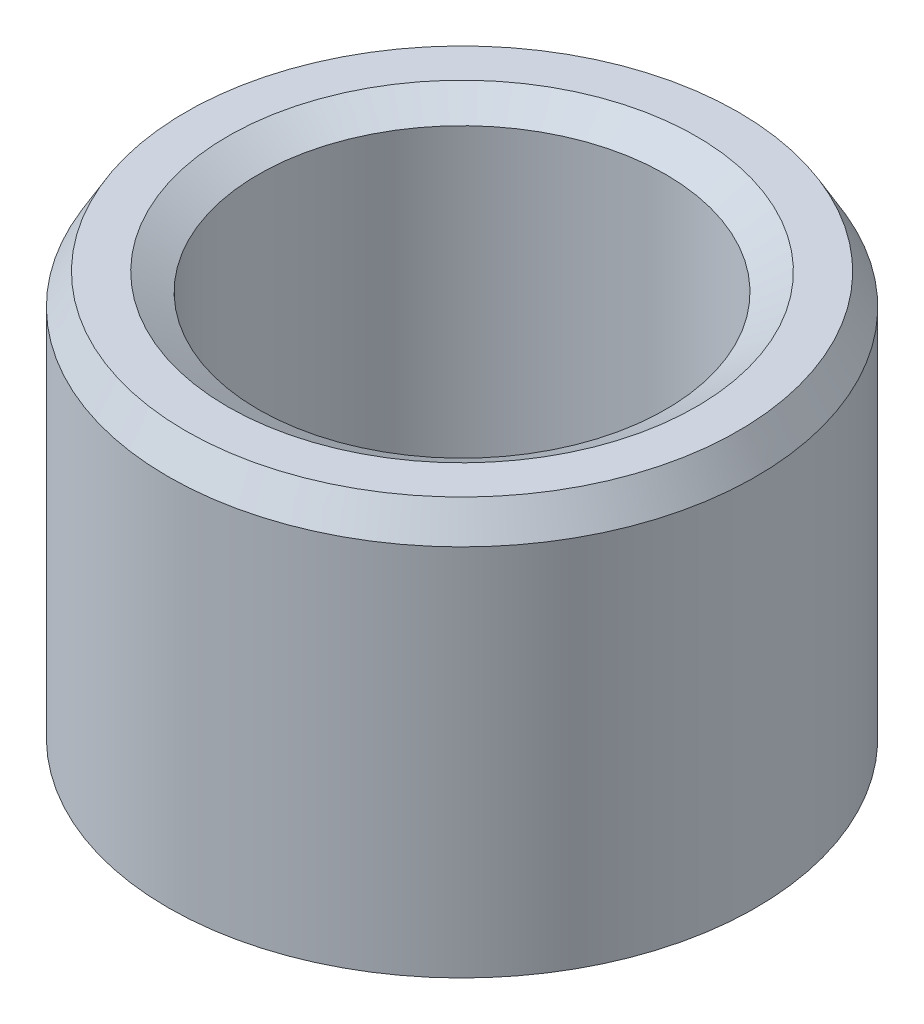
from build123d import *
from OCP.BRepFilletAPI import BRepFilletAPI_MakeChamfer

# Parameters (mm, degrees)
SKETCH1_R           = 35
BOSS_EXTRUDE1_DEPTH = 50.214335919
SKETCH2_R           = 24.247115256
CUT_EXTRUDE1_DEPTH  = 71.508719545
CHAMFER1_SIZE       = 3.652736509
CHAMFER1_SIZE2      = 2.108908407


with BuildPart() as part:
    # Sketch1 → Boss-Extrude1 (new body)
    with BuildSketch(Plane(origin=(0, 0, 0), x_dir=(1, 0, 0), z_dir=(0, 1, 0))):
        Circle(SKETCH1_R)
    extrude(amount=BOSS_EXTRUDE1_DEPTH)

    # Sketch2 → Cut-Extrude1 (cut, through all)
    with BuildSketch(Plane(origin=(0, 0, 0), x_dir=(1, 0, 0), z_dir=(0, 1, 0))):
        Circle(SKETCH2_R)
    extrude(amount=CUT_EXTRUDE1_DEPTH, mode=Mode.SUBTRACT)

    # Chamfer1: one chamfer whose edges measure the first distance from different faces: ONE call of the kernel's chamfer builder (chamfer() names one face for all edges)
    chamfer1_edges_1 = [part.edges().sort_by_distance(p)[0] for p in [
        (-24.247115256, 50.214335919, 0),
    ]]
    chamfer1_side_1 = [part.faces().sort_by_distance(p)[0] for p in [
        (-34.010050506, 50.214335919, 0),
    ]]
    chamfer1_edges_2 = [part.edges().sort_by_distance(p)[0] for p in [
        (-24.247115256, 0, 0),
    ]]
    chamfer1_side_2 = [part.faces().sort_by_distance(p)[0] for p in [
        (-24.247115256, 25.10716796, 0),
    ]]
    chamfer1_edges_3 = [part.edges().sort_by_distance(p)[0] for p in [
        (-35, 0, 0),
    ]]
    chamfer1_side_3 = [part.faces().sort_by_distance(p)[0] for p in [
        (-34.010050506, 0, 0),
    ]]
    chamfer1_edges_4 = [part.edges().sort_by_distance(p)[0] for p in [
        (-35, 50.214335919, 0),
    ]]
    chamfer1_side_4 = [part.faces().sort_by_distance(p)[0] for p in [
        (-35, 25.10716796, 0),
    ]]
    chamfer1 = BRepFilletAPI_MakeChamfer(part.part.solid().wrapped)
    for e in chamfer1_edges_1:
        chamfer1.Add(CHAMFER1_SIZE, CHAMFER1_SIZE2, e.wrapped, chamfer1_side_1[0].wrapped)  # the first distance lies on this face
    for e in chamfer1_edges_2:
        chamfer1.Add(CHAMFER1_SIZE, CHAMFER1_SIZE2, e.wrapped, chamfer1_side_2[0].wrapped)  # the first distance lies on this face
    for e in chamfer1_edges_3:
        chamfer1.Add(CHAMFER1_SIZE, CHAMFER1_SIZE2, e.wrapped, chamfer1_side_3[0].wrapped)  # the first distance lies on this face
    for e in chamfer1_edges_4:
        chamfer1.Add(CHAMFER1_SIZE, CHAMFER1_SIZE2, e.wrapped, chamfer1_side_4[0].wrapped)  # the first distance lies on this face
    add(Compound.cast(chamfer1.Shape()), mode=Mode.REPLACE)


solid = part.part
